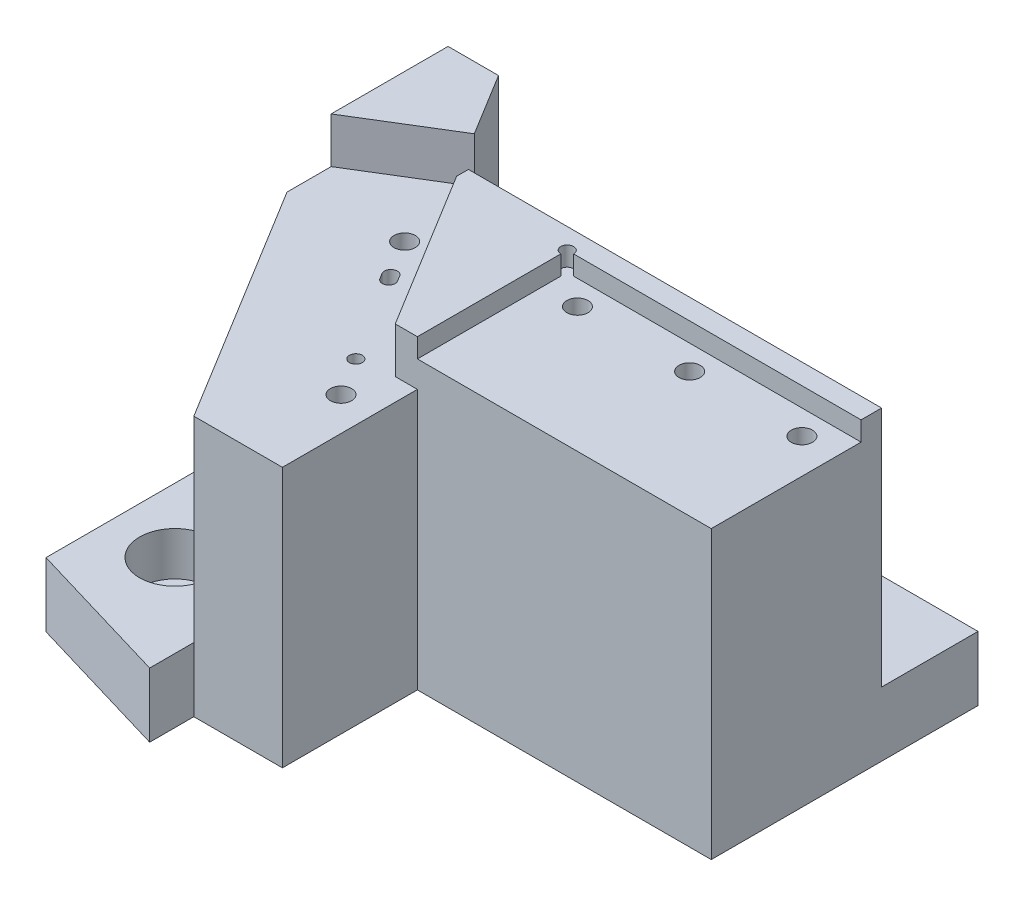
from build123d import *

# Parameters (mm, degrees)
SKETCH_1_W                = 57
SKETCH_1_H                = 25
EXTRUDE_1_DEPTH           = 44.599999974
SKETCH_5_W                = 25
SKETCH_5_H                = 3
EXTRUDE_2_DEPTH           = 5.6273
SKETCH_6_W                = 57
SKETCH_6_H                = 3
EXTRUDE_3_DEPTH           = 1.6927
CUT_EXTRUDE_START         = -5.6527
SKETCH_7_W                = 27.592148155
SKETCH_7_H                = 60.039562987
CUT_EXTRUDE_1_DEPTH       = 5.6527
EXTRUDE_4_DEPTH           = 30
CUT_EXTRUDE_START_2       = -7.1
CUT_EXTRUDE_2_DEPTH       = 7.1
SKETCH_13_W               = 35.6273
SKETCH_13_H               = 47.5
EXTRUDE_5_DEPTH           = 40.5
EXTRUDE_6_REACH           = 100.635
SKETCH_14_W               = 1.5
SKETCH_14_H               = 47.599999992
EXTRUDE_7_DEPTH           = 7.1
FILLET_1_R                = 1
CUT_EXTRUDE_5_DEPTH       = 79.643181523
EXTRUDE_9_DEPTH           = 7.1
CUT_EXTRUDE_6_DEPTH       = 30.499999975
SKETCH_24_W               = 81.3473
SKETCH_24_H               = 10
EXTRUDE_10_DEPTH          = 15
OTHER_1_DEPTH             = 3
SKETCH_28_W               = 62.5
SKETCH_28_H               = 10.000000003
EXTRUDE_12_DEPTH          = 1.1
EXTRUDE_13_DEPTH          = 30.499999983
EXTRUDE_14_DEPTH          = 7.1
HOLE_WIZARD_1_AT_2_COUNT  = 2
HOLE_WIZARD_1_AT_2_PITCH  = 35
HOLE_WIZARD_1_AT_3_COUNT  = 2
HOLE_WIZARD_1_AT_3_PITCH  = 69.106579117
CUT_EXTRUDE_7_DEPTH       = 7.1
EXTRUDE_15_DEPTH          = 30.499999983
MM_2_D                    = 4
MM_2_DEPTH                = 5
MM_2_TIP                  = 1.201721238
HOLE_WIZARD_M4_2_D        = 3.3
HOLE_WIZARD_M4_2_DEPTH    = 10.1
HOLE_WIZARD_M4_2_TIP      = 0.991420021
CUT_EXTRUDE_9_DEPTH       = 5
CUT_EXTRUDE_10_DEPTH      = 4
MM_3_D                    = 2
MM_3_DEPTH                = 4
MM_3_TIP                  = 0.600860619
EXTRUDE_17_REACH          = 100.453
CUT_EXTRUDE_11_DEPTH      = 98.181703369
CUT_EXTRUDE_11_DEPTH_BACK = 2
SKETCH_45_W               = 49.558122087
SKETCH_45_H               = 30.499999975
HOLE_WIZARD_M4_3_D        = 3.3
HOLE_WIZARD_M4_3_DEPTH    = 10.1
HOLE_WIZARD_M4_3_TIP      = 0.991420021
EXTRUDE_18_REACH          = 99.199
SKETCH_51_W               = 22.944452165
SKETCH_51_H               = 10.000000002
FILLET_START              = -36
FILLET_2_DEPTH            = 39.000000001
CUT_EXTRUDE_12_DEPTH      = 7.1


with BuildPart() as part:
    # 草图1 → 凸台-拉伸1 (new body)
    with BuildSketch(Plane(origin=(0, 0, 0), x_dir=(1, 0, 0), z_dir=(0, 1, 0))):
        Rectangle(SKETCH_1_W, SKETCH_1_H)
    extrude(amount=-EXTRUDE_1_DEPTH)

    # 草图5 → 凸台-拉伸2 (add)
    with BuildSketch(Plane.ZY.offset(28.5)):
        with Locations((0, 1.5)):
            Rectangle(SKETCH_5_W, SKETCH_5_H)
    extrude(amount=-EXTRUDE_2_DEPTH)

    # 草图6 → 凸台-拉伸3 (add)
    with BuildSketch(Plane(origin=(0, 0, -12.5), x_dir=(-1, 0, 0), z_dir=(0, 0, -1))):
        with Locations((0, 1.5)):
            Rectangle(SKETCH_6_W, SKETCH_6_H)
    extrude(amount=-EXTRUDE_3_DEPTH)

    # 草图7 → 切除-拉伸1 (cut)
    with BuildSketch(Plane(origin=(28.5, 0, 0), x_dir=(0, 0, -1), z_dir=(1, 0, 0)).offset(CUT_EXTRUDE_START)):
        with Locations((-1.296074078, -14.58021848)):
            Rectangle(SKETCH_7_W, SKETCH_7_H)
    extrude(amount=CUT_EXTRUDE_1_DEPTH, mode=Mode.SUBTRACT)

    # 草图10 → 凸台-拉伸4 (add)
    with BuildSketch(Plane.ZY.offset(28.5)):
        Polygon((12.5, 3), (-12.5, 3), (-12.5, -44.599999977), (12.5, -44.599999976), align=None)
    extrude(amount=EXTRUDE_4_DEPTH)

    # 草图11 → 切除-拉伸2 (cut)
    with BuildSketch(Plane(origin=(0, 3, 0), x_dir=(1, 0, 0), z_dir=(0, 1, 0)).offset(CUT_EXTRUDE_START_2)):
        Polygon((-53.367671823, 12.5), (-38.04765212, -12.5), (-58.5, -12.5), (-58.5, 12.5), align=None)
    extrude(amount=CUT_EXTRUDE_2_DEPTH, mode=Mode.SUBTRACT)

    # 草图13 → 凸台-拉伸5 (add, through all)
    with BuildSketch(Plane(origin=(0, -4.1, 0), x_dir=(1, 0, 0), z_dir=(0, 1, 0))):
        with Locations((-40.68635, -9.75)):
            Rectangle(SKETCH_13_W, SKETCH_13_H)
    extrude(amount=-EXTRUDE_5_DEPTH)

    # 凸台-拉伸6: up to this plane
    extrude_6_end = Plane(origin=(-53.367671823, -36.400132102, -12.5), z_dir=(0.8526401643542372, 0, -0.5224985647157124))
    # 草图14 → 凸台-拉伸6 (add, up to the surface)
    with BuildSketch(Plane(origin=(22.8473, 0, 0), x_dir=(0, 0, -1), z_dir=(1, 0, 0)), mode=Mode.PRIVATE) as extrude_6_sk1:
        with Locations((13.25, -20.799999978)):
            Rectangle(SKETCH_14_W, SKETCH_14_H)
    extrude_6_tool1 = split(extrude(extrude_6_sk1.sketch, amount=-EXTRUDE_6_REACH, mode=Mode.PRIVATE), bisect_by=extrude_6_end, keep=Keep.BOTH, mode=Mode.PRIVATE)
    add(extrude_6_tool1.solids().sort_by_distance((22.8473, -20.8, -13.25))[0])

    # 草图15 → 凸台-拉伸7 (add)
    with BuildSketch(Plane(origin=(0, -4.1, 0), x_dir=(1, 0, 0), z_dir=(0, 1, 0))):
        Polygon((-51.701058733, 9.780334617), (-58.5, 5.61393805), (-58.5, 14), (-54.286873005, 14), align=None)
    extrude(amount=EXTRUDE_7_DEPTH)

    # 圆角1
    fillet_1_edges = [part.edges().sort_by_distance(p)[0] for p in [
        (-51.701058733, -0.55, -9.780334617),
    ]]
    fillet(fillet_1_edges, radius=FILLET_1_R)

    # 草图20 → 切除-拉伸5 (cut, through all)
    with BuildSketch(Plane(origin=(0, -4.1, 0), x_dir=(1, 0, 0), z_dir=(0, 1, 0))):
        with BuildLine():
            Line((-43.174657089, 15.005320264), (-26.319375153, -12.5))
            Line((-26.319375153, -12.5), (-38.04765212, -12.5))
            Line((-38.04765212, -12.5), (-51.178560168, 8.927694453))
            ThreePointArc((-51.178560168, 8.927694453), (-51.797754969, 9.377565808), (-52.553698897, 9.257836052))
            Line((-52.553698897, 9.257836052), (-58.5, 5.61393805))
            Line((-58.5, 5.61393805), (-58.5, 14))
            Line((-58.5, 14), (-44.815190658, 14))
            Line((-44.815190658, 14), (-43.174657089, 15.005320264))
        make_face()
    extrude(amount=CUT_EXTRUDE_5_DEPTH, mode=Mode.SUBTRACT)

    # 草图22 → 凸台-拉伸9 (add)
    with BuildSketch(Plane(origin=(0, -4.1, 0), x_dir=(1, 0, 0), z_dir=(0, 1, 0))):
        Polygon((-32.974322707, -30.348325438), (-22.8727, -25.0658203), (-22.8727, -33.5), (-32.974322707, -33.5), (-39.001203228, -33.5), align=None)
    extrude(amount=EXTRUDE_9_DEPTH)

    # 草图23 → 切除-拉伸6 (cut)
    with BuildSketch(Plane(origin=(0, -4.1, 0), x_dir=(1, 0, 0), z_dir=(0, 1, 0))):
        Polygon((-58.5, -1.680855591), (-39.001203228, -33.5), (-58.5, -33.5), align=None)
    extrude(amount=-CUT_EXTRUDE_6_DEPTH, mode=Mode.SUBTRACT)

    # 草图24 → 凸台-拉伸10 (add)
    with BuildSketch(Plane(origin=(0, 0, -14), x_dir=(-1, 0, 0), z_dir=(0, 0, -1))):
        with Locations((17.82635, -39.599999974)):
            Rectangle(SKETCH_24_W, SKETCH_24_H)
    extrude(amount=EXTRUDE_10_DEPTH)

    # 孔1: read off the stored shape, not the designer's step
    # 孔1 outline → 孔1 (cut)
    with BuildSketch(Plane(origin=(0, 0, 0), x_dir=(1, 0, 0), z_dir=(0, 1, 0))):
        with BuildLine():
            Line((-22.8727, 10.8073), (-21.8727, 10.8073))
            ThreePointArc((-21.8727, 10.8073), (-23.579806781, 11.514406781), (-22.8727, 9.8073))
            Line((-22.8727, 9.8073), (-22.8727, 10.8073))
        make_face()
    extrude(amount=OTHER_1_DEPTH, mode=Mode.SUBTRACT)

    # 草图28 → 凸台-拉伸12 (add)
    with BuildSketch(Plane.ZY.offset(58.5)):
        with Locations((2.25, -39.599999975)):
            Rectangle(SKETCH_28_W, SKETCH_28_H)
    extrude(amount=EXTRUDE_12_DEPTH)

    # 草图29 → 凸台-拉伸13 (add)
    with BuildSketch(Plane(origin=(4e-09, -34.599999975, 5e-09), x_dir=(1.0, 1.086597846680947e-10, 0), z_dir=(-1.086597846680947e-10, 1.0, -1.4160452072639443e-10))):
        Polygon((-58.500000004, -1.680855586), (-59.600000004, 12.594263512), (-59.600000004, 29.000000005), (-51.750607864, 29.000000005), (-42.55859604, 14.000000001), align=None)
    extrude(amount=EXTRUDE_13_DEPTH)

    # 草图30 → 凸台-拉伸14 (add)
    with BuildSketch(Plane(origin=(0, -4.1, 0), x_dir=(1, 0, 0), z_dir=(0, 1, 0))):
        Polygon((-59.600000003, 12.594263512), (-59.600000003, 29.000000009), (-51.750607861, 29), (-45.787149913, 19.268521086), (-58.576752378, 11.431042615), (-59.600000003, 10.803995664), align=None)
    extrude(amount=EXTRUDE_14_DEPTH)

    # 草图32 → 打孔尺寸(%根据)内六角圆柱头螺钉的类型1 (revolve, cut)
    with BuildSketch(Plane(origin=(2.8473, -34.599999978, -21.5), x_dir=(-0.7071067811865476, 2.3295446271224704e-11, 0.7071067811865476), z_dir=(0.7071067811865476, 1.7696358743338434e-10, 0.7071067811865476))):
        Polygon((0, 0), (0, 53.482840043), (3.3, 51.5), (3.3, 6.8), (5.5, 6.8), (5.5, 0), align=None)
    hole_wizard_1 = revolve(axis=Axis((2.847299999, -28.249999978, -21.500000001), (1.0865978671906271e-10, -1.0, 1.4160451561207773e-10)), mode=Mode.SUBTRACT)

    # 打孔尺寸(%根据)内六角圆柱头螺钉的类型1 at 2: 打孔尺寸(%根据)内六角圆柱头螺钉的类型1 ×2
    with Locations(*[(-i * HOLE_WIZARD_1_AT_2_PITCH, 0, 0) for i in range(1, HOLE_WIZARD_1_AT_2_COUNT)]):
        add(hole_wizard_1, mode=Mode.SUBTRACT)

    # 打孔尺寸(%根据)内六角圆柱头螺钉的类型1 at 3: 打孔尺寸(%根据)内六角圆柱头螺钉的类型1 ×2
    with Locations(*[Vector(-0.7589335294836127, 9.742788097477754e-12, 0.6511681025860729) * (i * HOLE_WIZARD_1_AT_3_PITCH) for i in range(1, HOLE_WIZARD_1_AT_3_COUNT)]):
        add(hole_wizard_1, mode=Mode.SUBTRACT)

    # 草图33 → 切除-拉伸7 (cut)
    with BuildSketch(Plane(origin=(0, 3, 0), x_dir=(1, 0, 0), z_dir=(0, 1, 0))):
        Polygon((-22.8727, -25.0658203), (-39.001203228, -33.5), (-22.8727, -33.5), align=None)
    extrude(amount=-CUT_EXTRUDE_7_DEPTH, mode=Mode.SUBTRACT)

    # 草图34 → 凸台-拉伸15 (add)
    with BuildSketch(Plane.XZ.offset(4.1)):
        Polygon((-59.600000003, -10.803995664), (-59.600000003, -12.594263512), (-59.46826756, -10.884721409), align=None)
    extrude(amount=EXTRUDE_15_DEPTH)

    # 大小mm 暗销孔2
    with Locations(Plane(origin=(-42.152699999, -44.599999982, -16.499999999), x_dir=(0, -1.42e-10, -1.0), z_dir=(1.09e-10, -1.0, 1.42e-10))):
        with Locations((0, 0)):
            Hole(MM_2_D / 2, depth=MM_2_DEPTH)
            with Locations((0, 0, -(MM_2_DEPTH + MM_2_TIP / 2))):  # 118° drill point
                Cone(0, MM_2_D / 2, MM_2_TIP, mode=Mode.SUBTRACT)

    # M4 螺纹孔2
    with Locations(Plane(origin=(-43.780367958, -4.1, -6.42434629), x_dir=(0, 0, 1), z_dir=(0, 1, 0))):
        with Locations((0, 0), (25.579204931, 15.674956941)):
            Hole(HOLE_WIZARD_M4_2_D / 2, depth=HOLE_WIZARD_M4_2_DEPTH)
            with Locations((0, 0, -(HOLE_WIZARD_M4_2_DEPTH + HOLE_WIZARD_M4_2_TIP / 2))):  # 118° drill point
                Cone(0, HOLE_WIZARD_M4_2_D / 2, HOLE_WIZARD_M4_2_TIP, mode=Mode.SUBTRACT)

    # 草图41 → 切除-拉伸9 (cut)
    with BuildSketch(Plane.XZ.offset(44.599999975)):
        with BuildLine():
            Line((12.347299996, -14.500000005), (13.347299996, -14.500000005))
            ThreePointArc((13.347299996, -14.500000005), (15.347299996, -16.500000005), (13.347299996, -18.500000005))
            Line((13.347299996, -18.500000005), (12.347299996, -18.500000005))
            ThreePointArc((12.347299996, -18.500000005), (10.347299996, -16.500000005), (12.347299996, -14.500000005))
        make_face()
        with BuildLine():
            Line((-51.600000004, 12.999999995), (-51.600000004, 13.999999995))
            ThreePointArc((-51.600000004, 13.999999995), (-49.600000004, 15.999999995), (-47.600000004, 13.999999995))
            Line((-47.600000004, 13.999999995), (-47.600000004, 12.999999995))
            ThreePointArc((-47.600000004, 12.999999995), (-49.600000004, 10.999999995), (-51.600000004, 12.999999995))
        make_face()
    extrude(amount=-CUT_EXTRUDE_9_DEPTH, mode=Mode.SUBTRACT)

    # 草图42 → 切除-拉伸10 (cut)
    with BuildSketch(Plane(origin=(0, -4.1, 0), x_dir=(1, 0, 0), z_dir=(0, 1, 0))):
        with BuildLine():
            Line((-40.714268887, -0.492953507), (-41.236767452, 0.359686657))
            ThreePointArc((-41.236767452, 0.359686657), (-40.906625852, 1.734825386), (-39.531487123, 1.404683786))
            Line((-39.531487123, 1.404683786), (-39.008988558, 0.552043622))
            ThreePointArc((-39.008988558, 0.552043622), (-39.339130158, -0.823095107), (-40.714268887, -0.492953507))
        make_face()
    extrude(amount=-CUT_EXTRUDE_10_DEPTH, mode=Mode.SUBTRACT)

    # 大小mm 暗销孔3
    with Locations(Plane(origin=(-31.76290097, -4.1, 13.18637749), x_dir=(0, 0, 1), z_dir=(0, 1, 0))):
        with Locations((0, 0)):
            Hole(MM_3_D / 2, depth=MM_3_DEPTH)
            with Locations((0, 0, -(MM_3_DEPTH + MM_3_TIP / 2))):  # 118° drill point
                Cone(0, MM_3_D / 2, MM_3_TIP, mode=Mode.SUBTRACT)

    # 凸台-拉伸17: up to this plane
    extrude_17_end = Plane(origin=(-59.6, 0, 0), z_dir=(-1, 0, 0))
    # 草图44 → 凸台-拉伸17 (add, up to the surface)
    with BuildSketch(Plane(origin=(-58.28344624, -6e-09, 4.491156285), x_dir=(0.07682938910269173, 7.509930174891973e-12, 0.9970442542686394), z_dir=(-0.9970442542686394, -9.745922515180297e-11, 0.07682938910269173)), mode=Mode.PRIVATE) as extrude_17_sk1:
        Polygon((-15.421459608, -4.099999994), (-15.421459608, -34.599999977), (-2.818631853, -34.599999975), (-2.818631853, -4.099999994), align=None)
    extrude_17_tool1 = split(extrude(extrude_17_sk1.sketch, amount=EXTRUDE_17_REACH, mode=Mode.PRIVATE), bisect_by=extrude_17_end, keep=Keep.BOTH, mode=Mode.PRIVATE)
    add(extrude_17_tool1.solids().sort_by_distance((-58.984134, -19.35, -4.601933))[0])

    # 草图45 → 切除-拉伸11 (cut, two sides: drawn at the far end of the back side and taken through both)
    with BuildSketch(Plane(origin=(-43.278048766, 0, 26.520822393), x_dir=(0.5224985647157137, 0, 0.8526401643542364), z_dir=(-0.8526401643542364, 0, 0.5224985647157137)).offset(-CUT_EXTRUDE_11_DEPTH_BACK)):
        with Locations((-13.32361838, -19.349999988)):
            Rectangle(SKETCH_45_W, SKETCH_45_H)
    extrude(amount=CUT_EXTRUDE_11_DEPTH + CUT_EXTRUDE_11_DEPTH_BACK, mode=Mode.SUBTRACT)

    # M4 螺纹孔3
    with Locations(Plane(origin=(17.448859608, 0, -6.998100273), x_dir=(0, 0, 1), z_dir=(0, 1, 0))):
        with Locations((0, 0), (0, -17.4625), (0, -34.925)):
            Hole(HOLE_WIZARD_M4_3_D / 2, depth=HOLE_WIZARD_M4_3_DEPTH)
            with Locations((0, 0, -(HOLE_WIZARD_M4_3_DEPTH + HOLE_WIZARD_M4_3_TIP / 2))):  # 118° drill point
                Cone(0, HOLE_WIZARD_M4_3_D / 2, HOLE_WIZARD_M4_3_TIP, mode=Mode.SUBTRACT)

    # 凸台-拉伸18: up to this plane
    extrude_18_end = Plane(origin=(-57.114062804, -35.075, 34.295556517), z_dir=(-0.2847374793032547, -5.216625563406907e-15, 0.9586055329905147))
    # 草图51 → 凸台-拉伸18 (add, up to the surface)
    with BuildSketch(Plane.XY.offset(33.5), mode=Mode.PRIVATE) as extrude_18_sk1:
        with Locations((-48.127773918, -39.599999976)):
            Rectangle(SKETCH_51_W, SKETCH_51_H)
    extrude_18_tool1 = split(extrude(extrude_18_sk1.sketch, amount=EXTRUDE_18_REACH, mode=Mode.PRIVATE), bisect_by=extrude_18_end, keep=Keep.BOTH, mode=Mode.PRIVATE)
    add(extrude_18_tool1.solids().sort_by_distance((-48.127774, -39.6, 33.5))[0])

    # 圆角2: read off the stored shape, not the designer's step
    # 圆角2 outline → 圆角2 (add)
    with BuildSketch(Plane(origin=(0, 0, 0), x_dir=(1.0, 2.18834822099883e-11, 0), z_dir=(-2.18834822099883e-11, 1.0, 0)).offset(FILLET_START)):
        with BuildLine():
            Line((-42.558596039, 14), (-41.438542222, 14))
            ThreePointArc((-41.438542222, 14), (-42.415784705, 14.255007986), (-43.143822551, 14.955002871))
            Line((-43.143822551, 14.955002871), (-42.558596039, 14))
        make_face()
    extrude(amount=FILLET_2_DEPTH)

    # 草图53 → 切除-拉伸12 (cut)
    with BuildSketch(Plane(origin=(0, 3, 0), x_dir=(1, 0, 0), z_dir=(0, 1, 0)).offset(CUT_EXTRUDE_START_2)):
        with BuildLine():
            Line((-41.438542222, 14), (-41.438542222, 12.172238288))
            Line((-41.438542222, 12.172238288), (-43.14382255, 14.955002871))
            ThreePointArc((-43.14382255, 14.955002871), (-42.415784705, 14.255007986), (-41.438542222, 14))
        make_face()
    extrude(amount=CUT_EXTRUDE_12_DEPTH, mode=Mode.SUBTRACT)


solid = part.part
